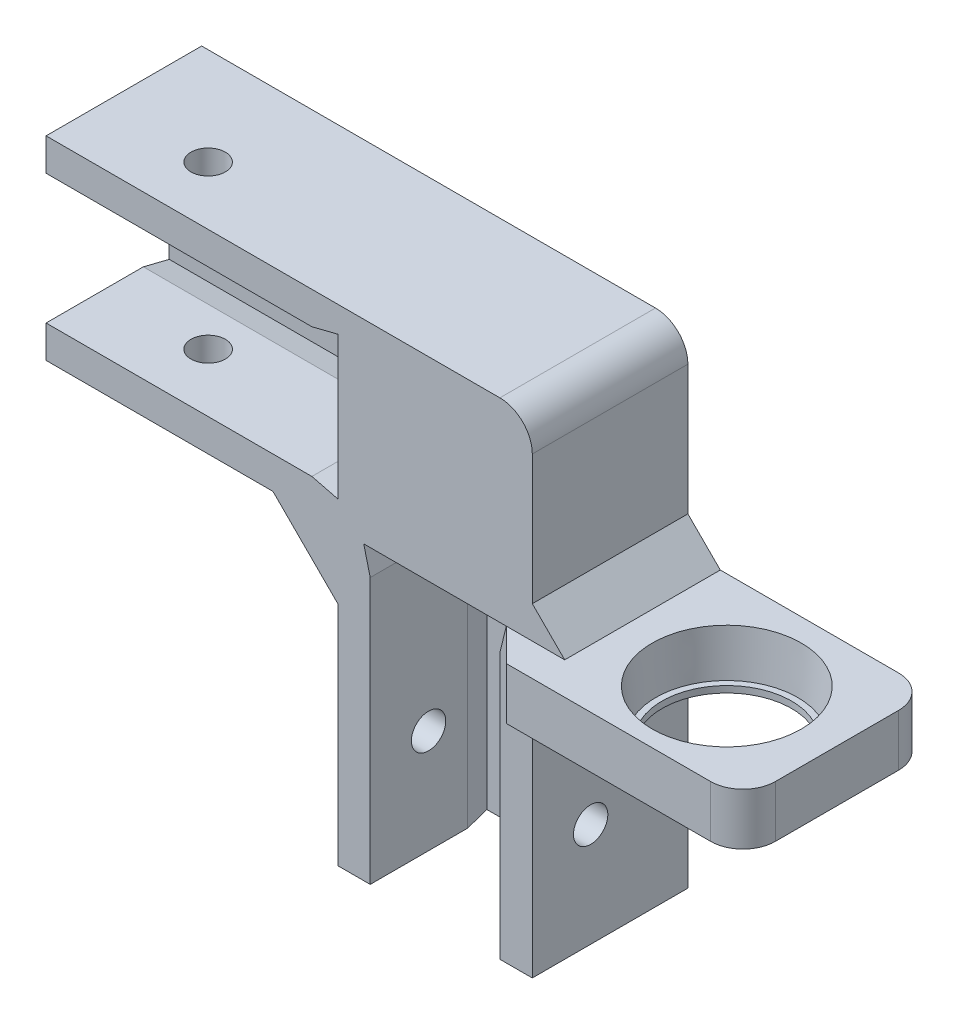
from build123d import *

# Parameters (mm, degrees)
SKETCH1_W               = 75
SKETCH1_H               = 75
BOSS_EXTRUDE1_DEPTH     = 24
SKETCH2_W               = 20
SKETCH2_H               = 19
CUT_EXTRUDE1_DEPTH      = 45
SKETCH3_W               = 19
SKETCH3_H               = 20
CUT_EXTRUDE2_DEPTH      = 45
CUT_EXTRUDE3_DEPTH      = 109.747413762
CUT_EXTRUDE3_DEPTH_BACK = 109.747413762
SKETCH4_W               = 45
SKETCH4_H               = 45
FILLET1_R               = 5
CHAMFER1_SIZE           = 10
SKETCH5_W               = 29
SKETCH5_H               = 8
BOSS_EXTRUDE2_DEPTH     = 37.5
SKETCH6_R               = 11.5
CUT_EXTRUDE4_DEPTH      = 7
FILLET2_R               = 5
CHAMFER3_SIZE           = 5
CUT_EXTRUDE5_DEPTH      = 93.146622293
CUT_EXTRUDE5_DEPTH_BACK = 93.146622293
SKETCH7_R               = 2.65
CUT_EXTRUDE6_DEPTH      = 105.986903945
CUT_EXTRUDE6_DEPTH_BACK = 105.986903945
SKETCH8_R               = 2.65
SKETCH9_R               = 2.65
CUT_EXTRUDE7_DEPTH      = 10
SKETCH10_R              = 2.65
CUT_EXTRUDE8_DEPTH      = 10
CUT_EXTRUDE12_DEPTH     = 19
CUT_EXTRUDE13_REACH     = 111.959
CUT_EXTRUDE14_REACH     = 140.283
SKETCH14_R              = 10
CUT_EXTRUDE15_DEPTH     = 10
CHAMFER5_SIZE           = 4
CHAMFER6_SIZE           = 1
CHAMFER8_SIZE2          = 0.550911948
CHAMFER8_SIZE           = 7


with BuildPart() as part:
    # Sketch1 → Boss-Extrude1 (new body)
    with BuildSketch(Plane.XY):
        with Locations((37.5, 37.5)):
            Rectangle(SKETCH1_W, SKETCH1_H)
    extrude(amount=BOSS_EXTRUDE1_DEPTH)

    # Sketch2 → Cut-Extrude1 (cut)
    with BuildSketch(Plane.XZ):
        with Locations((15, 14.5)):
            Rectangle(SKETCH2_W, SKETCH2_H)
    extrude(amount=-CUT_EXTRUDE1_DEPTH, mode=Mode.SUBTRACT)

    # Sketch3 → Cut-Extrude2 (cut)
    with BuildSketch(Plane(origin=(75, 0, 0), x_dir=(0, 0, -1), z_dir=(1, 0, 0))):
        with Locations((-14.5, 60)):
            Rectangle(SKETCH3_W, SKETCH3_H)
    extrude(amount=-CUT_EXTRUDE2_DEPTH, mode=Mode.SUBTRACT)

    # Sketch4 → Cut-Extrude3 (cut, two sides: drawn at the far end of the back side and taken through both)
    with BuildSketch(Plane.XY.offset(24).offset(-CUT_EXTRUDE3_DEPTH_BACK)):
        with Locations((52.5, 22.5)):
            Rectangle(SKETCH4_W, SKETCH4_H)
    extrude(amount=CUT_EXTRUDE3_DEPTH + CUT_EXTRUDE3_DEPTH_BACK, mode=Mode.SUBTRACT)

    # Fillet1
    fillet1_edges = [part.edges().sort_by_distance(p)[0] for p in [
        (0, 75, 12),
    ]]
    fillet(fillet1_edges, radius=FILLET1_R)

    # Chamfer1
    chamfer1_edges = [part.edges().sort_by_distance(p)[0] for p in [
        (30, 45, 12),
    ]]
    chamfer(chamfer1_edges, length=CHAMFER1_SIZE)

    # Sketch5 → Boss-Extrude2 (add)
    with BuildSketch(Plane.ZY):
        with Locations((14.5, 41)):
            Rectangle(SKETCH5_W, SKETCH5_H)
    extrude(amount=BOSS_EXTRUDE2_DEPTH)

    # Sketch6 → Cut-Extrude4 (cut)
    with BuildSketch(Plane(origin=(0, 45, 0), x_dir=(1, 0, 0), z_dir=(0, 1, 0))):
        with Locations(Location((-21, -15.000000001, 0), (0, 0, 180))):
            Circle(SKETCH6_R)
    extrude(amount=-CUT_EXTRUDE4_DEPTH, mode=Mode.SUBTRACT)

    # Fillet2
    fillet2_edges = [part.edges().sort_by_distance(p)[0] for p in [
        (-37.5, 41, 29),
        (-37.5, 41, 0),
    ]]
    fillet(fillet2_edges, radius=FILLET2_R)

    # Chamfer3
    chamfer3_edges = [part.edges().sort_by_distance(p)[0] for p in [
        (0, 45, 12),
        (0, 37, 12),
    ]]
    chamfer(chamfer3_edges, length=CHAMFER3_SIZE)

    # Sketch7 → Cut-Extrude5 (cut, two sides: drawn at the far end of the back side and taken through both)
    with BuildSketch(Plane.XZ.offset(-45).offset(-CUT_EXTRUDE5_DEPTH_BACK)):
        with Locations((59, 15)):
            Circle(SKETCH7_R)
    extrude(amount=CUT_EXTRUDE5_DEPTH + CUT_EXTRUDE5_DEPTH_BACK, mode=Mode.SUBTRACT)

    # Sketch8 → Cut-Extrude6 (cut, two sides: drawn at the far end of the back side and taken through both)
    with BuildSketch(Plane(origin=(30, 0, 0), x_dir=(0, 0, -1), z_dir=(1, 0, 0)).offset(-CUT_EXTRUDE6_DEPTH_BACK)):
        with Locations((-15, 16)):
            Circle(SKETCH8_R)
    extrude(amount=CUT_EXTRUDE6_DEPTH + CUT_EXTRUDE6_DEPTH_BACK, mode=Mode.SUBTRACT)

    # Sketch9 → Cut-Extrude7 (cut)
    with BuildSketch(Plane.XY.offset(5)):
        with Locations((15, 22.5)):
            Circle(SKETCH9_R)
    extrude(amount=-CUT_EXTRUDE7_DEPTH, mode=Mode.SUBTRACT)

    # Sketch10 → Cut-Extrude8 (cut)
    with BuildSketch(Plane.XY.offset(5)):
        with Locations((52.5, 60)):
            Circle(SKETCH10_R)
    extrude(amount=-CUT_EXTRUDE8_DEPTH, mode=Mode.SUBTRACT)

    # Sketch11 → Cut-Extrude12 (cut)
    with BuildSketch(Plane.XY.offset(24)):
        Polygon((34, 70), (30, 71), (30, 70), align=None)
        Polygon((30, 50), (34, 50), (30, 49), align=None)
        Polygon((26, 45), (25, 41), (25, 45), align=None)
        Polygon((5, 45), (4, 45), (5, 41), align=None)
    extrude(amount=-CUT_EXTRUDE12_DEPTH, mode=Mode.SUBTRACT)

    # Cut-Extrude13: up to this face of the body (flat: up to its plane)
    cut_extrude13_end = Plane(part.part.faces().sort_by_distance((15, 45, 14.5))[0])
    # Sketch12 → Cut-Extrude13 (cut, up to the picked face)
    with BuildSketch(Plane.XZ, mode=Mode.PRIVATE) as cut_extrude13_sk1:
        Polygon((5, 5), (4, 5), (5, 9), align=None)
    cut_extrude13_tool1 = split(extrude(cut_extrude13_sk1.sketch, amount=-CUT_EXTRUDE13_REACH, mode=Mode.PRIVATE), bisect_by=cut_extrude13_end, keep=Keep.BOTH, mode=Mode.PRIVATE)
    # Sketch12 → Cut-Extrude13 (cut, up to the picked face)
    with BuildSketch(Plane.XZ, mode=Mode.PRIVATE) as cut_extrude13_sk2:
        Polygon((25, 5), (26, 5), (25, 9), align=None)
    cut_extrude13_tool2 = split(extrude(cut_extrude13_sk2.sketch, amount=-CUT_EXTRUDE13_REACH, mode=Mode.PRIVATE), bisect_by=cut_extrude13_end, keep=Keep.BOTH, mode=Mode.PRIVATE)
    add(cut_extrude13_tool1.solids().sort_by(Axis((4.666667, 0, 6.333333), (0, 1, 0)))[0], mode=Mode.SUBTRACT)
    add(cut_extrude13_tool2.solids().sort_by(Axis((25.333333, 0, 6.333333), (0, 1, 0)))[0], mode=Mode.SUBTRACT)

    # Cut-Extrude14: up to this face of the body (flat: up to its plane)
    cut_extrude14_end = Plane(part.part.faces().sort_by_distance((30, 60, 14.5))[0])
    # Sketch13 → Cut-Extrude14 (cut, up to the picked face)
    with BuildSketch(Plane(origin=(75, 0, 0), x_dir=(0, 0, -1), z_dir=(1, 0, 0)), mode=Mode.PRIVATE) as cut_extrude14_sk1:
        Polygon((-5, 50), (-5, 49), (-9, 50), align=None)
    cut_extrude14_tool1 = split(extrude(cut_extrude14_sk1.sketch, amount=-CUT_EXTRUDE14_REACH, mode=Mode.PRIVATE), bisect_by=cut_extrude14_end, keep=Keep.BOTH, mode=Mode.PRIVATE)
    # Sketch13 → Cut-Extrude14 (cut, up to the picked face)
    with BuildSketch(Plane(origin=(75, 0, 0), x_dir=(0, 0, -1), z_dir=(1, 0, 0)), mode=Mode.PRIVATE) as cut_extrude14_sk2:
        Polygon((-5, 70), (-5, 71), (-9, 70), align=None)
    cut_extrude14_tool2 = split(extrude(cut_extrude14_sk2.sketch, amount=-CUT_EXTRUDE14_REACH, mode=Mode.PRIVATE), bisect_by=cut_extrude14_end, keep=Keep.BOTH, mode=Mode.PRIVATE)
    add(cut_extrude14_tool1.solids().sort_by(Axis((75, 49.666667, 6.333333), (-1, 0, 0)))[0], mode=Mode.SUBTRACT)
    add(cut_extrude14_tool2.solids().sort_by(Axis((75, 70.333333, 6.333333), (-1, 0, 0)))[0], mode=Mode.SUBTRACT)

    # Sketch14 → Cut-Extrude15 (cut)
    with BuildSketch(Plane(origin=(0, 38, 0), x_dir=(1, 0, 0), z_dir=(0, 1, 0))):
        with Locations(Location((-21, -15.000000001, 0), (0, 0, 180))):
            Circle(SKETCH14_R)
    extrude(amount=-CUT_EXTRUDE15_DEPTH, mode=Mode.SUBTRACT)

    # Chamfer5
    chamfer5_edges = [part.edges().sort_by_distance(p)[0] for p in [
        (0, 41, 24),
    ]]
    chamfer(chamfer5_edges, length=CHAMFER5_SIZE)

    # Chamfer6
    chamfer6_edges = [part.edges().sort_by_distance(p)[0] for p in [
        (0, 41, 29),
    ]]
    chamfer(chamfer6_edges, length=CHAMFER6_SIZE - 0.0001)  # a hair under: the kernel refuses the full size

    # Chamfer8
    chamfer8_edges = [part.edges().sort_by_distance(p)[0] for p in [
        (-9.5, 38, 15.000000001),
    ]]
    chamfer8_side = [part.faces().sort_by_distance(p)[0] for p in [
        (-9.5, 38.011018239, 15.000000001),
    ]]
    chamfer(chamfer8_edges, length=CHAMFER8_SIZE - 0.0001, length2=CHAMFER8_SIZE2 - 0.0001, reference=chamfer8_side[0])  # a hair under: the kernel refuses the full size


with BuildPart() as body_2:
    # Mirror1: mirrored copy
    add(part.part.mirror(Plane(origin=(75, 0, 24), x_dir=(0, 0, 1), z_dir=(-1, 0, 0))))


solid = body_2.part
